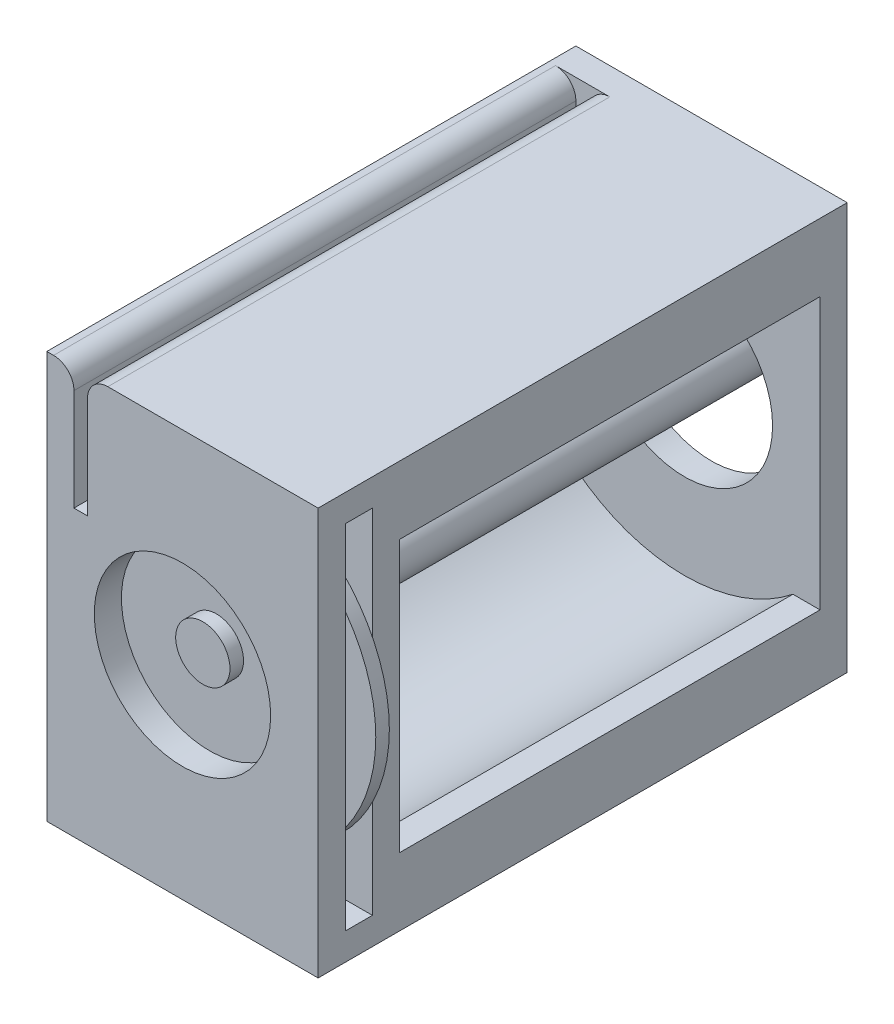
from build123d import *

# Parameters (mm, degrees)
SKETCH1_W               = 20
SKETCH1_H               = 30
SKETCH1_R               = 6.5
BOSS_EXTRUDE1_DEPTH     = 2
BOSS_EXTRUDE4_DEPTH     = 34
BOSS_EXTRUDE5_START     = 37
SKETCH1_9_W             = 20
SKETCH1_9_H             = 30
SKETCH1_9_R             = 6.5
BOSS_EXTRUDE5_DEPTH     = 2
BOSS_EXTRUDE6_START     = 33
BOSS_EXTRUDE6_OUTLINE_W = 20
BOSS_EXTRUDE6_OUTLINE_H = 30
BOSS_EXTRUDE6_OUTLINE_R = 6.5
BOSS_EXTRUDE6_DEPTH     = 2
BOSS_EXTRUDE7_DEPTH     = 39
SKETCH2_W               = 1
SKETCH2_H               = 9
CUT_EXTRUDE1_DEPTH      = 37
FILLET2_R               = 1.5
BOSS_EXTRUDE8_START     = 35.5
SKETCH4_R               = 11.75
SKETCH4_R_2             = 2
BOSS_EXTRUDE8_DEPTH     = 1
BOSS_EXTRUDE9_START     = -5
BOSS_EXTRUDE9_OUTLINE_R = 2
BOSS_EXTRUDE9_DEPTH     = 42.5


# Read off the part's stored shape, not the designer's step: Boss-Extrude6, Boss-Extrude9
with BuildPart() as part:
    # Sketch1 → Boss-Extrude1 (new body)
    with BuildSketch(Plane.XY):
        Rectangle(SKETCH1_W, SKETCH1_H)
        Circle(SKETCH1_R, mode=Mode.SUBTRACT)
    extrude(amount=BOSS_EXTRUDE1_DEPTH)

    # Sketch1<7> → Boss-Extrude4 (add)
    with BuildSketch(Plane.XY):
        with BuildLine():
            Line((10, 15), (-10, 15))
            Line((-10, 15), (-10, 10))
            Line((-10, 10), (-8, 10))
            ThreePointArc((-8, 10), (0, 12.806248475), (8, 10))
            Line((8, 10), (10, 10))
            Line((10, 10), (10, 15))
        make_face()
        with BuildLine():
            Line((10, -10), (8, -10))
            ThreePointArc((8, -10), (0, -12.806248475), (-8, -10))
            Line((-8, -10), (-10, -10))
            Line((-10, -10), (-10, -15))
            Line((-10, -15), (10, -15))
            Line((10, -15), (10, -10))
        make_face()
    extrude(amount=BOSS_EXTRUDE4_DEPTH)

    # Boss-Extrude6 outline → Boss-Extrude6 (add)
    with BuildSketch(Plane.XY.offset(BOSS_EXTRUDE6_START)):
        Rectangle(BOSS_EXTRUDE6_OUTLINE_W, BOSS_EXTRUDE6_OUTLINE_H)
        Circle(BOSS_EXTRUDE6_OUTLINE_R, mode=Mode.SUBTRACT)
    extrude(amount=BOSS_EXTRUDE6_DEPTH)



with BuildPart() as body_2:
    # Sketch1<9> → Boss-Extrude5 (new body)
    with BuildSketch(Plane.XY.offset(BOSS_EXTRUDE5_START)):
        Rectangle(SKETCH1_9_W, SKETCH1_9_H)
        Circle(SKETCH1_9_R, mode=Mode.SUBTRACT)
    extrude(amount=BOSS_EXTRUDE5_DEPTH)


with BuildPart() as part_1:
    add(part.part)

    add(body_2.part)  # Boss-Extrude7 merges body 2
    # Sketch1<11> → Boss-Extrude7 (add)
    with BuildSketch(Plane.XY):
        Polygon((10, 13), (10, 15), (-10, 15), (-10, 13), (-8, 13), (8, 13), align=None)
        Polygon((10, -15), (10, -13), (8, -13), (-8, -13), (-10, -13), (-10, -15), align=None)
    extrude(amount=BOSS_EXTRUDE7_DEPTH)

    # Sketch2 → Cut-Extrude1 (cut)
    with BuildSketch(Plane.XY.offset(39)):
        with Locations((-7.5, 10.5)):
            Rectangle(SKETCH2_W, SKETCH2_H)
    extrude(amount=-CUT_EXTRUDE1_DEPTH, mode=Mode.SUBTRACT)

    # Fillet2
    fillet2_edges = [part_1.edges().sort_by_distance(p)[0] for p in [
        (-7, 15, 20.5),
        (-8, 15, 20.5),
    ]]
    fillet(fillet2_edges, radius=FILLET2_R)


with BuildPart() as body_2_2:
    # Sketch4 → Boss-Extrude8 (new body)
    with BuildSketch(Plane.XY.offset(BOSS_EXTRUDE8_START)):
        Circle(SKETCH4_R)
        Circle(SKETCH4_R_2, mode=Mode.SUBTRACT)
    extrude(amount=BOSS_EXTRUDE8_DEPTH)


with BuildPart() as body_3:
    # Boss-Extrude9 outline → Boss-Extrude9 (new body)
    with BuildSketch(Plane.XY.offset(BOSS_EXTRUDE9_START)):
        Circle(BOSS_EXTRUDE9_OUTLINE_R)
    extrude(amount=BOSS_EXTRUDE9_DEPTH)


solid = Compound([part_1.part, body_2_2.part, body_3.part])
